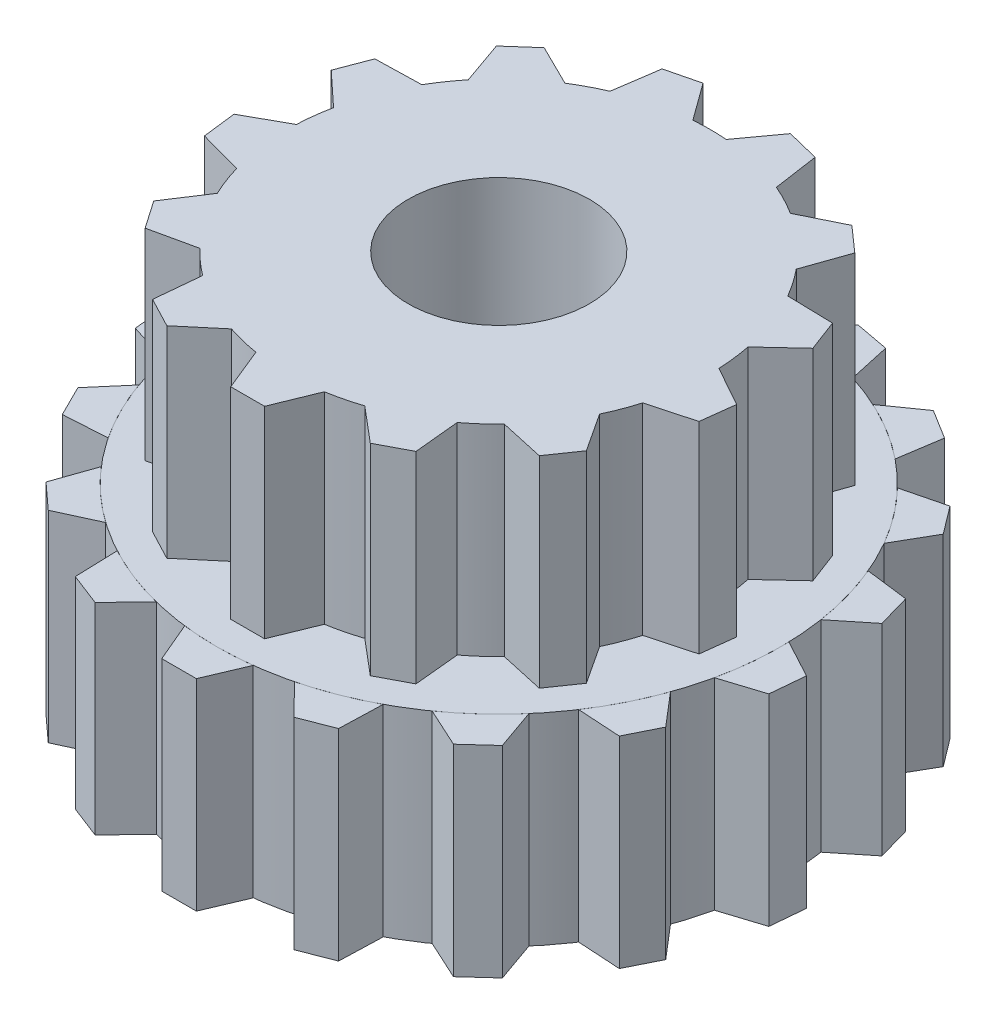
from build123d import *
from build123d.topology import SkipClean

# Parameters (mm, degrees)
SKETCH1_R            = 4.5
BOSS_EXTRUDE1_DEPTH  = 5
SKETCH12_R           = 10.5
SKETCH12_R_2         = 4.5
BOSS_EXTRUDE6_DEPTH  = 5
BOSS_EXTRUDE9_DEPTH  = 5
CIRPATTERN2_COUNT    = 13
BOSS_EXTRUDE10_START = 5
SKETCH17_R           = 10.5
SKETCH17_R_2         = 4.5
BOSS_EXTRUDE10_DEPTH = 5
BOSS_EXTRUDE11_START = 10
SKETCH20_R           = 14
SKETCH20_R_2         = 4.5
BOSS_EXTRUDE11_DEPTH = 10
BOSS_EXTRUDE12_DEPTH = 10
CIRPATTERN3_COUNT    = 17
BOSS_EXTRUDE13_DEPTH = 5
SKETCH27_R           = 4.5
CUT_EXTRUDE3_DEPTH   = 10


with BuildPart() as part:
    # Sketch1 → Boss-Extrude1 (new body)
    with BuildSketch(Plane(origin=(0, 0, 0), x_dir=(1, 0, 0), z_dir=(0, 1, 0))):
        with Locations(Location((0, 0, 0), (0, 0, 270))):
            Circle(SKETCH1_R)
    extrude(amount=BOSS_EXTRUDE1_DEPTH)

    # Sketch27 → Cut-Extrude3 (cut)
    with BuildSketch(Plane.XZ):
        with Locations(Location((0, 0, 0), (0, 0, 270))):
            Circle(SKETCH27_R)
    extrude(amount=-CUT_EXTRUDE3_DEPTH, mode=Mode.SUBTRACT)


with BuildPart() as body_2:
    # Sketch12 → Boss-Extrude6 (new body)
    with BuildSketch(Plane(origin=(0, 5, 0), x_dir=(-1, 0, 0), z_dir=(0, -1, 0))):
        with Locations(Location((0, 0, 0), (0, 0, 90))):
            Circle(SKETCH12_R)
        with Locations(Location((0, 0, 0), (0, 0, 270))):
            Circle(SKETCH12_R_2, mode=Mode.SUBTRACT)
    extrude(amount=BOSS_EXTRUDE6_DEPTH)



with BuildPart() as body_3:
    # Sketch13 → Boss-Extrude9 (new body)
    with BuildSketch(Plane.XZ):
        with BuildLine():
            Line((1.7, 10.361467078), (0.84, 12.471744064))
            Line((0.84, 12.471744064), (-0.84, 12.471744064))
            Line((-0.84, 12.471744064), (-1.7, 10.361467078))
            ThreePointArc((-1.7, 10.361467078), (0, 10.5), (1.7, 10.361467078))
        make_face()
    extrude(amount=-BOSS_EXTRUDE9_DEPTH)


with BuildPart() as cirpattern2_1:
    # CirPattern2: pattern copy
    add(body_3.part.rotate(Axis((0, 0, 0), (0, 1, 0)), 1 * 360 / CIRPATTERN2_COUNT))


with BuildPart() as cirpattern2_2:
    # CirPattern2: pattern copy
    add(body_3.part.rotate(Axis((0, 0, 0), (0, 1, 0)), 2 * 360 / CIRPATTERN2_COUNT))


with BuildPart() as cirpattern2_3:
    # CirPattern2: pattern copy
    add(body_3.part.rotate(Axis((0, 0, 0), (0, 1, 0)), 3 * 360 / CIRPATTERN2_COUNT))


with BuildPart() as cirpattern2_4:
    # CirPattern2: pattern copy
    add(body_3.part.rotate(Axis((0, 0, 0), (0, 1, 0)), 4 * 360 / CIRPATTERN2_COUNT))


with BuildPart() as cirpattern2_5:
    # CirPattern2: pattern copy
    add(body_3.part.rotate(Axis((0, 0, 0), (0, 1, 0)), 5 * 360 / CIRPATTERN2_COUNT))


with BuildPart() as cirpattern2_6:
    # CirPattern2: pattern copy
    add(body_3.part.rotate(Axis((0, 0, 0), (0, 1, 0)), 6 * 360 / CIRPATTERN2_COUNT))


with BuildPart() as cirpattern2_7:
    # CirPattern2: pattern copy
    add(body_3.part.rotate(Axis((0, 0, 0), (0, 1, 0)), 7 * 360 / CIRPATTERN2_COUNT))


with BuildPart() as cirpattern2_8:
    # CirPattern2: pattern copy
    add(body_3.part.rotate(Axis((0, 0, 0), (0, 1, 0)), 8 * 360 / CIRPATTERN2_COUNT))


with BuildPart() as cirpattern2_9:
    # CirPattern2: pattern copy
    add(body_3.part.rotate(Axis((0, 0, 0), (0, 1, 0)), 9 * 360 / CIRPATTERN2_COUNT))


with BuildPart() as cirpattern2_10:
    # CirPattern2: pattern copy
    add(body_3.part.rotate(Axis((0, 0, 0), (0, 1, 0)), 10 * 360 / CIRPATTERN2_COUNT))


with BuildPart() as cirpattern2_11:
    # CirPattern2: pattern copy
    add(body_3.part.rotate(Axis((0, 0, 0), (0, 1, 0)), 11 * 360 / CIRPATTERN2_COUNT))


with BuildPart() as cirpattern2_12:
    # CirPattern2: pattern copy
    add(body_3.part.rotate(Axis((0, 0, 0), (0, 1, 0)), 12 * 360 / CIRPATTERN2_COUNT))


with BuildPart() as body_2_1:
    with SkipClean():  # the faces are left unmerged after this step: merging them gives an invalid solid
        add(body_2.part)

        add(body_3.part)  # Boss-Extrude10 merges body 3

        add(cirpattern2_4.part)  # Boss-Extrude10 merges CirPattern2_4

        add(cirpattern2_5.part)  # Boss-Extrude10 merges CirPattern2_5

        add(cirpattern2_6.part)  # Boss-Extrude10 merges CirPattern2_6

        add(cirpattern2_7.part)  # Boss-Extrude10 merges CirPattern2_7

        add(cirpattern2_8.part)  # Boss-Extrude10 merges CirPattern2_8

        add(cirpattern2_9.part)  # Boss-Extrude10 merges CirPattern2_9

        add(cirpattern2_10.part)  # Boss-Extrude10 merges CirPattern2_10

        add(cirpattern2_11.part)  # Boss-Extrude10 merges CirPattern2_11

        add(cirpattern2_12.part)  # Boss-Extrude10 merges CirPattern2_12
        # Sketch17 → Boss-Extrude10 (add)
        # profile 1 of 11: a face of its own
        with BuildSketch(Plane.XZ.offset(BOSS_EXTRUDE10_START)):
            Circle(SKETCH17_R)
            with Locations(Location((0, 0, 0), (0, 0, 90))):
                Circle(SKETCH17_R_2, mode=Mode.SUBTRACT)
        # profile 2 of 11: a face of its own
        with BuildSketch(Plane.XZ.offset(BOSS_EXTRUDE10_START)):
            with BuildLine():
                ThreePointArc((-1.7, 10.361467078), (0, 10.5), (1.7, 10.361467078))
                Line((1.7, 10.361467078), (0.84, 12.471744064))
                Line((0.84, 12.471744064), (-0.84, 12.471744064))
                Line((-0.84, 12.471744064), (-1.7, 10.361467078))
            make_face()
        # profile 3 of 11: a face of its own
        with BuildSketch(Plane.XZ.offset(BOSS_EXTRUDE10_START)):
            with BuildLine():
                ThreePointArc((-6.320489091, 8.384594066), (-4.879593306, 9.297288269), (-3.309938604, 9.964652851))
                Line((-3.309938604, 9.964652851), (-5.052125401, 11.433548396))
                Line((-5.052125401, 11.433548396), (-6.539691524, 10.652813467))
                Line((-6.539691524, 10.652813467), (-6.320489091, 8.384594066))
            make_face()
        # profile 4 of 11: a face of its own
        with BuildSketch(Plane.XZ.offset(BOSS_EXTRUDE10_START)):
            with BuildLine():
                Line((-10.741218532, 6.393451686), (-9.493030301, 4.486911599))
                ThreePointArc((-9.493030301, 4.486911599), (-8.641330592, 5.964679841), (-7.561610162, 7.285056743))
                Line((-7.561610162, 7.285056743), (-9.786869757, 7.77606458))
                Line((-9.786869757, 7.77606458), (-10.741218532, 6.393451686))
            make_face()
        # profile 5 of 11: a face of its own
        with BuildSketch(Plane.XZ.offset(BOSS_EXTRUDE10_START)):
            with BuildLine():
                Line((-12.482061819, 0.669427172), (-10.490832673, -0.438668242))
                ThreePointArc((-10.490832673, -0.438668242), (-10.423443178, 1.265635143), (-10.08100796, 2.93654193))
                Line((-10.08100796, 2.93654193), (-12.279560196, 2.337178081))
                Line((-12.279560196, 2.337178081), (-12.482061819, 0.669427172))
            make_face()
        # profile 6 of 11: a face of its own
        with BuildSketch(Plane.XZ.offset(BOSS_EXTRUDE10_START)):
            with BuildLine():
                Line((-11.363415169, -5.207955039), (-9.085311708, -5.263754475))
                ThreePointArc((-9.085311708, -5.263754475), (-9.817670548, -3.723351314), (-10.290968324, -2.08469925))
                Line((-10.290968324, -2.08469925), (-11.95915138, -3.637127751))
                Line((-11.95915138, -3.637127751), (-11.363415169, -5.207955039))
            make_face()
        # profile 7 of 11: a face of its own
        with BuildSketch(Plane.XZ.offset(BOSS_EXTRUDE10_START)):
            with BuildLine():
                Line((-7.641547048, -9.892257513), (-5.59845532, -8.882977993))
                ThreePointArc((-5.59845532, -8.882977993), (-6.962787912, -7.859362856), (-8.143391864, -6.628360955))
                Line((-8.143391864, -6.628360955), (-8.899045105, -8.778211447))
                Line((-8.899045105, -8.778211447), (-7.641547048, -9.892257513))
            make_face()
        # profile 8 of 11: a face of its own
        with BuildSketch(Plane.XZ.offset(BOSS_EXTRUDE10_START)):
            with BuildLine():
                Line((-2.169092589, -12.310363006), (-0.829060287, -10.467218305))
                ThreePointArc((-0.829060287, -10.467218305), (-2.512814475, -10.194889083), (-4.130262466, -9.653545046))
                Line((-4.130262466, -9.653545046), (-3.800274842, -11.90831269))
                Line((-3.800274842, -11.90831269), (-2.169092589, -12.310363006))
            make_face()
        # profile 9 of 11: a face of its own
        with BuildSketch(Plane.XZ.offset(BOSS_EXTRUDE10_START)):
            with BuildLine():
                Line((0.829060287, -10.467218305), (2.169092589, -12.310363006))
                Line((2.169092589, -12.310363006), (3.800274842, -11.90831269))
                Line((3.800274842, -11.90831269), (4.130262466, -9.653545046))
                ThreePointArc((4.130262466, -9.653545046), (2.512814475, -10.194889083), (0.829060287, -10.467218305))
            make_face()
        # profile 10 of 11: a face of its own
        with BuildSketch(Plane.XZ.offset(BOSS_EXTRUDE10_START)):
            with BuildLine():
                ThreePointArc((8.143391864, -6.628360955), (6.962787912, -7.859362856), (5.59845532, -8.882977993))
                Line((5.59845532, -8.882977993), (7.641547048, -9.892257513))
                Line((7.641547048, -9.892257513), (8.899045105, -8.778211447))
                Line((8.899045105, -8.778211447), (8.143391864, -6.628360955))
            make_face()
        # profile 11 of 11: a face of its own
        with BuildSketch(Plane.XZ.offset(BOSS_EXTRUDE10_START)):
            with BuildLine():
                ThreePointArc((10.290968324, -2.08469925), (9.817670548, -3.723351314), (9.085311708, -5.263754475))
                Line((9.085311708, -5.263754475), (11.363415169, -5.207955039))
                Line((11.363415169, -5.207955039), (11.95915138, -3.637127751))
                Line((11.95915138, -3.637127751), (10.290968324, -2.08469925))
            make_face()
        extrude(amount=-BOSS_EXTRUDE10_DEPTH)

    # Sketch20 → Boss-Extrude11 (add)
    with SkipClean():  # the faces are left unmerged after this step: merging them gives an invalid solid
        with BuildSketch(Plane.XZ.offset(5).offset(BOSS_EXTRUDE11_START)):
            with Locations(Location((0, 0, 0), (0, 0, 270))):
                Circle(SKETCH20_R)
            with Locations(Location((0, 0, 0), (0, 0, 90))):
                Circle(SKETCH20_R_2, mode=Mode.SUBTRACT)
        extrude(amount=-BOSS_EXTRUDE11_DEPTH)
    add(body_2_1.part.scale(1), mode=Mode.REPLACE)  # the faces are merged on a copy


    add(cirpattern2_1.part)  # Boss-Extrude13 merges CirPattern2_1

    add(cirpattern2_2.part)  # Boss-Extrude13 merges CirPattern2_2

    add(cirpattern2_3.part)  # Boss-Extrude13 merges CirPattern2_3
    # Sketch25 → Boss-Extrude13 (add)
    with BuildSketch(Plane.XZ):
        with BuildLine():
            Line((6.320489091, 8.384594066), (6.539691524, 10.652813467))
            Line((6.539691524, 10.652813467), (5.052125401, 11.433548396))
            Line((5.052125401, 11.433548396), (3.309938604, 9.964652851))
            ThreePointArc((3.309938604, 9.964652851), (4.879593306, 9.297288269), (6.320489091, 8.384594066))
        make_face()
        with BuildLine():
            Line((9.493030301, 4.486911599), (10.741218532, 6.393451686))
            Line((10.741218532, 6.393451686), (9.786869757, 7.77606458))
            Line((9.786869757, 7.77606458), (7.561610162, 7.285056743))
            ThreePointArc((7.561610162, 7.285056743), (8.641330592, 5.964679841), (9.493030301, 4.486911599))
        make_face()
        with BuildLine():
            Line((10.490832673, -0.438668242), (12.482061819, 0.669427172))
            Line((12.482061819, 0.669427172), (12.279560196, 2.337178081))
            Line((12.279560196, 2.337178081), (10.08100796, 2.93654193))
            ThreePointArc((10.08100796, 2.93654193), (10.423443178, 1.265635143), (10.490832673, -0.438668242))
        make_face()
    extrude(amount=BOSS_EXTRUDE13_DEPTH)


with BuildPart() as body_6:
    # Sketch21 → Boss-Extrude12 (new body)
    with BuildSketch(Plane.XZ.offset(15)):
        with BuildLine():
            Line((1.7, 13.896402412), (0.86, 15.876725103))
            Line((0.86, 15.876725103), (-0.86, 15.876725103))
            Line((-0.86, 15.876725103), (-1.7, 13.896402412))
            ThreePointArc((-1.7, 13.896402412), (0, 14), (1.7, 13.896402412))
        make_face()
    extrude(amount=-BOSS_EXTRUDE12_DEPTH)


with BuildPart() as cirpattern3_1:
    # CirPattern3: pattern copy
    add(body_6.part.rotate(Axis((0, 0, 0), (0, 1, 0)), 1 * 360 / CIRPATTERN3_COUNT))


with BuildPart() as cirpattern3_2:
    # CirPattern3: pattern copy
    add(body_6.part.rotate(Axis((0, 0, 0), (0, 1, 0)), 2 * 360 / CIRPATTERN3_COUNT))


with BuildPart() as cirpattern3_3:
    # CirPattern3: pattern copy
    add(body_6.part.rotate(Axis((0, 0, 0), (0, 1, 0)), 3 * 360 / CIRPATTERN3_COUNT))


with BuildPart() as cirpattern3_4:
    # CirPattern3: pattern copy
    add(body_6.part.rotate(Axis((0, 0, 0), (0, 1, 0)), 4 * 360 / CIRPATTERN3_COUNT))


with BuildPart() as cirpattern3_5:
    # CirPattern3: pattern copy
    add(body_6.part.rotate(Axis((0, 0, 0), (0, 1, 0)), 5 * 360 / CIRPATTERN3_COUNT))


with BuildPart() as cirpattern3_6:
    # CirPattern3: pattern copy
    add(body_6.part.rotate(Axis((0, 0, 0), (0, 1, 0)), 6 * 360 / CIRPATTERN3_COUNT))


with BuildPart() as cirpattern3_7:
    # CirPattern3: pattern copy
    add(body_6.part.rotate(Axis((0, 0, 0), (0, 1, 0)), 7 * 360 / CIRPATTERN3_COUNT))


with BuildPart() as cirpattern3_8:
    # CirPattern3: pattern copy
    add(body_6.part.rotate(Axis((0, 0, 0), (0, 1, 0)), 8 * 360 / CIRPATTERN3_COUNT))


with BuildPart() as cirpattern3_9:
    # CirPattern3: pattern copy
    add(body_6.part.rotate(Axis((0, 0, 0), (0, 1, 0)), 9 * 360 / CIRPATTERN3_COUNT))


with BuildPart() as cirpattern3_10:
    # CirPattern3: pattern copy
    add(body_6.part.rotate(Axis((0, 0, 0), (0, 1, 0)), 10 * 360 / CIRPATTERN3_COUNT))


with BuildPart() as cirpattern3_11:
    # CirPattern3: pattern copy
    add(body_6.part.rotate(Axis((0, 0, 0), (0, 1, 0)), 11 * 360 / CIRPATTERN3_COUNT))


with BuildPart() as cirpattern3_12:
    # CirPattern3: pattern copy
    add(body_6.part.rotate(Axis((0, 0, 0), (0, 1, 0)), 12 * 360 / CIRPATTERN3_COUNT))


with BuildPart() as cirpattern3_13:
    # CirPattern3: pattern copy
    add(body_6.part.rotate(Axis((0, 0, 0), (0, 1, 0)), 13 * 360 / CIRPATTERN3_COUNT))


with BuildPart() as cirpattern3_14:
    # CirPattern3: pattern copy
    add(body_6.part.rotate(Axis((0, 0, 0), (0, 1, 0)), 14 * 360 / CIRPATTERN3_COUNT))


with BuildPart() as cirpattern3_15:
    # CirPattern3: pattern copy
    add(body_6.part.rotate(Axis((0, 0, 0), (0, 1, 0)), 15 * 360 / CIRPATTERN3_COUNT))


with BuildPart() as cirpattern3_16:
    # CirPattern3: pattern copy
    add(body_6.part.rotate(Axis((0, 0, 0), (0, 1, 0)), 16 * 360 / CIRPATTERN3_COUNT))


solid = Compound([body_2_1.part, body_6.part, cirpattern3_1.part, cirpattern3_2.part, cirpattern3_3.part, cirpattern3_4.part, cirpattern3_5.part, cirpattern3_6.part, cirpattern3_7.part, cirpattern3_8.part, cirpattern3_9.part, cirpattern3_10.part, cirpattern3_11.part, cirpattern3_12.part, cirpattern3_13.part, cirpattern3_14.part, cirpattern3_15.part, cirpattern3_16.part])
